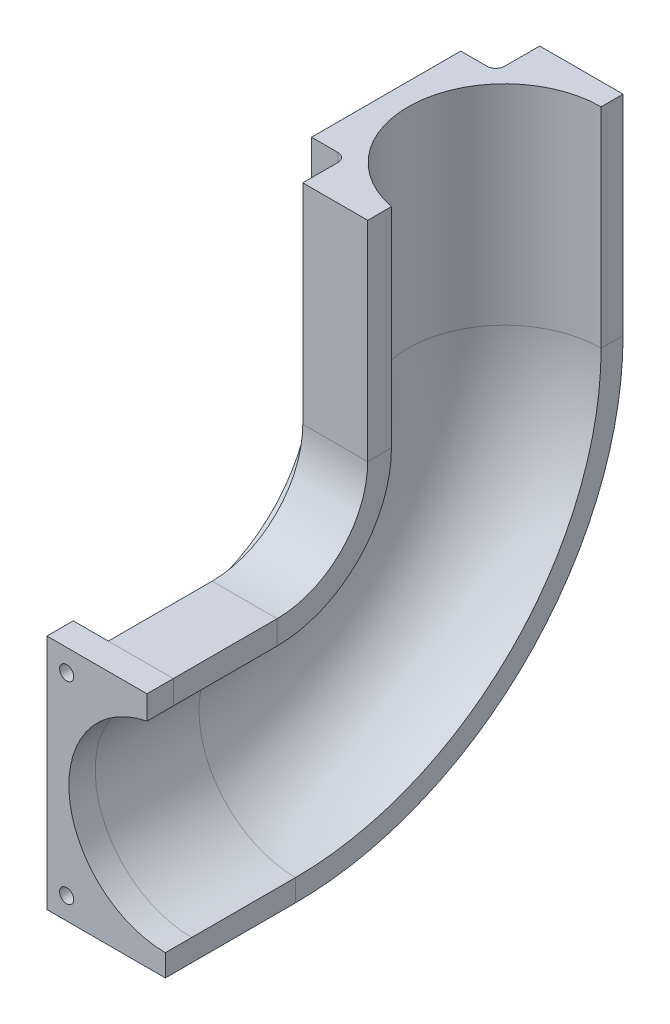
from build123d import *

# Parameters (mm, degrees)
EXTRUDE_1_DEPTH     = 6
SKETCH_4_R          = 1.605
CUT_EXTRUDE_1_DEPTH = 10
SWEEP_START         = -4.2
SWEEP_1_2_DEPTH     = 4.2


# Read off the part's stored shape, not the designer's step: 切除-扫描1
with BuildPart() as part:
    # 草图1 → 凸台-拉伸1 (new body)
    with BuildSketch(Plane.XY):
        with BuildLine():
            Line((0, 0), (-27, 0))
            Line((-27, 0), (-27, -54))
            Line((-27, -54), (0, -54))
            Line((0, -54), (0, -49))
            ThreePointArc((0, -49), (-22, -27), (0, -5))
            Line((0, -5), (0, 0))
        make_face()
    extrude(amount=-EXTRUDE_1_DEPTH)

    # Sweep 1: sweep along a path in 草图3
    with BuildLine(Plane(origin=(0, 0, 0), x_dir=(0, 0, -1), z_dir=(1, 0, 0))) as sweep_1_path:
        Line((6, -27), (29.659999985, -27.000851338))
        ThreePointArc((29.659999985, -27.000851338), (63.354746468, -13.045095672), (77.311714535, 20.649148631))
        Line((77.311714535, 20.649148631), (77.311714535, 68.299148631))
    # 草图2 → Sweep 1 (sweep)
    with BuildSketch(Plane(origin=(0, 0, -6), x_dir=(-1, 0, 0), z_dir=(0, 0, -1))):
        with BuildLine():
            Line((19, 0), (19, -8))
            ThreePointArc((19, -8), (19.585786438, -9.414213562), (21, -10))
            Line((21, -10), (27, -10))
            Line((27, -10), (27, -44))
            Line((27, -44), (21, -44))
            ThreePointArc((21, -44), (19.585786438, -44.585786438), (19, -46))
            Line((19, -46), (19, -54))
            Line((19, -54), (0, -54))
            Line((0, -54), (0, -49))
            ThreePointArc((0, -49), (22, -27), (0, -5))
            Line((0, -5), (0, 0))
            Line((0, 0), (19, 0))
        make_face()
    sweep(path=sweep_1_path.line)

    # 草图4 → 切除-拉伸1 (cut)
    with BuildSketch(Plane(origin=(0, 0, -6), x_dir=(-1, 0, 0), z_dir=(0, 0, -1))):
        with Locations((22.5, -5)):
            Circle(SKETCH_4_R)
    cut_extrude_1 = extrude(amount=-CUT_EXTRUDE_1_DEPTH, mode=Mode.SUBTRACT)

    # 镜向1: 切除-拉伸1 across plane
    add(cut_extrude_1.mirror(Plane.ZX.offset(-27)), mode=Mode.SUBTRACT)

    # Sweep 1 2 outline → Sweep 1 2 (cut)
    with BuildSketch(Plane.YZ.offset(SWEEP_START)):
        with BuildLine():
            Line((-0.000851338, -29.659999985), (0, -6))
            Line((0, -6), (0, 1))
            Line((0, 1), (-7, 1))
            Line((-7, 1), (-7, -57))
            Line((-7, -57), (68.298417771, -57))
            Line((68.298417771, -57), (68.298177112, -50.311714553))
            Line((68.298177112, -50.311714553), (20.648177112, -50.311714553))
            ThreePointArc((20.648177112, -50.311714553), (6.046443933, -44.262519896), (-0.000851338, -29.659999985))
        make_face()
    extrude(amount=SWEEP_1_2_DEPTH, mode=Mode.SUBTRACT)


solid = part.part
